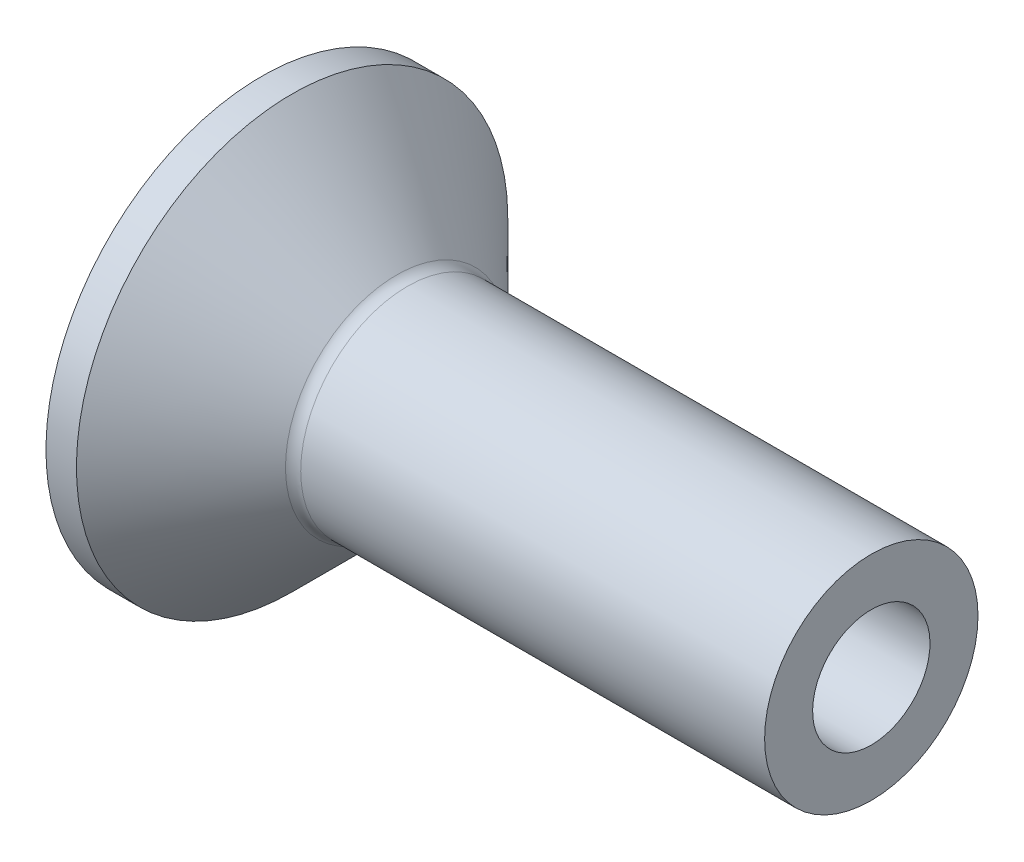
from build123d import *

# Parameters (mm, degrees)
FILLET1_R = 0.1


with BuildPart() as part:
    # Sketch1 → Base-Revolve (revolve)
    with BuildSketch(Plane(origin=(-0.2925, -1.7075, 0), x_dir=(0, 1, 0), z_dir=(0, 0, 1))):
        Polygon((1.7075, -0.2925), (3.1225, -0.2925), (3.1225, -0.4925), (2.4075, -1.2075), (2.4075, -4.2925), (1.7075, -4.2925), align=None)
    revolve(axis=Axis((-2.3225, 0, 0), (1, 0, 0)))

    # Fillet1
    fillet1_edges = [part.edges().sort_by_distance(p)[0] for p in [
        (0.915, -0.7, 0),
    ]]
    fillet(fillet1_edges, radius=FILLET1_R)

    # Sketch2 → Cut-Revolve1 (revolve, cut)
    with BuildSketch(Plane(origin=(-3.060649304, -3.445649304, 0), x_dir=(0, 1, 0), z_dir=(0, 0, 1))):
        Polygon((3.445649304, -5.620930431), (3.830649304, -5.900649304), (3.830649304, -7.060649304), (3.445649304, -7.060649304), align=None)
    revolve(axis=Axis((-1.185160934, 0, 0), (1, 0, 0)), mode=Mode.SUBTRACT)


solid = part.part
